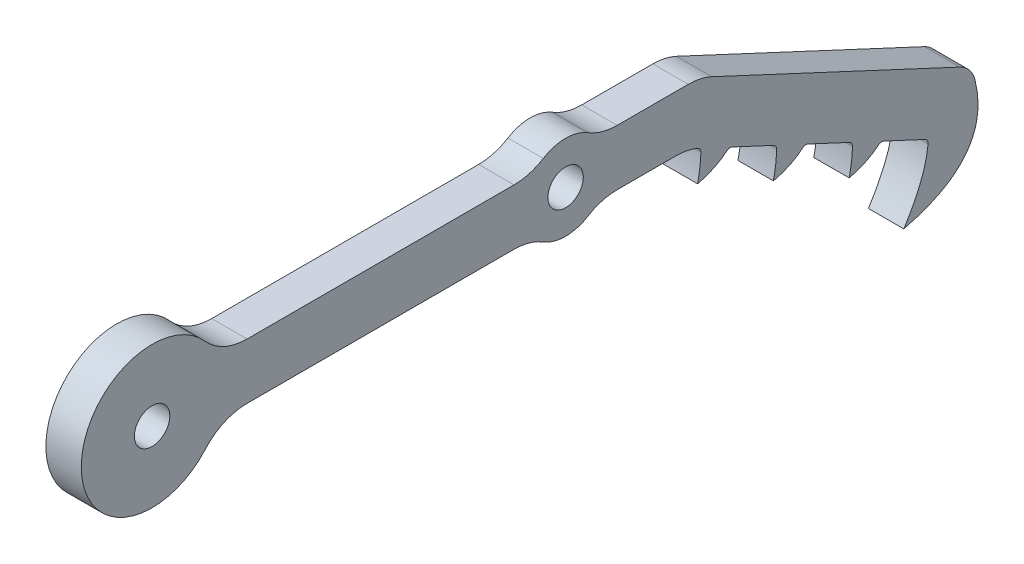
from build123d import *

# Parameters (mm, degrees)
BOSS_EXTRUDE1_DEPTH        = 6.35
F_1_4_0_2500_DOWEL_HOLE4_D = 6.35
FILLET1_R                  = 10
FILLET2_R                  = 10
FILLET4_R                  = 5
FILLET5_R                  = 1
FILLET6_R                  = 10


with BuildPart() as part:
    # Sketch1 → Boss-Extrude1 (new body)
    with BuildSketch(Plane(origin=(0, 0, 0), x_dir=(0, 0, -1), z_dir=(1, 0, 0))):
        with BuildLine():
            Line((-28.374994089, 49.86223243), (28.354545267, 49.86223243))
            ThreePointArc((28.354545267, 49.86223243), (34.104710482, 47.24223243), (39.854875697, 49.86223243))
            Line((39.854875697, 49.86223243), (56.104710487, 49.86223243))
            Line((56.104710487, 49.86223243), (58.379362515, 48.80154477))
            add(Edge.make_bspline(
                [(58.379362515, 48.80154477), (58.386228757, 46.363071997), (57.773854653, 43.567008128)],
                knots=[0, 0, 0, 1, 1, 1], degree=2))
            add(Edge.make_bspline(
                [(63.433148606, 46.444925613), (61.354068213, 44.407555536), (57.773854653, 43.567008128)],
                knots=[0.61808465, 0.61808465, 0.61808465, 1, 1, 1], degree=2))
            Line((63.433148606, 46.444925613), (71.973979321, 42.462270844))
            add(Edge.make_bspline(
                [(71.973979321, 42.462270844), (71.980845562, 40.023798071), (71.368471459, 37.227734202)],
                knots=[0, 0, 0, 1, 1, 1], degree=2))
            add(Edge.make_bspline(
                [(77.027765412, 40.105651687), (74.948685018, 38.06828161), (71.368471459, 37.227734202)],
                knots=[0.61808465, 0.61808465, 0.61808465, 1, 1, 1], degree=2))
            Line((77.027765412, 40.105651687), (85.568596126, 36.122996918))
            add(Edge.make_bspline(
                [(85.568596126, 36.122996918), (85.575462368, 33.684524145), (84.963088264, 30.888460276)],
                knots=[0, 0, 0, 1, 1, 1], degree=2))
            add(Edge.make_bspline(
                [(90.622382217, 33.766377761), (88.543301824, 31.729007684), (84.963088264, 30.888460276)],
                knots=[0.61808465, 0.61808465, 0.61808465, 1, 1, 1], degree=2))
            Line((90.622382217, 33.766377761), (99.163212932, 29.783722992))
            add(Edge.make_bspline(
                [(99.163212932, 29.783722992), (98.939072146, 24.65005498), (94.755179462, 18.075155142)],
                knots=[0, 0, 0, 1, 1, 1], degree=2))
            add(Edge.make_bspline(
                [(94.755179462, 18.075155142), (112.208752339, 22.33534385), (106.773416656, 37.268805905)],
                knots=[0.444949083, 0.444949083, 0.444949083, 1.444949083, 1.444949083, 1.444949083], degree=2))
            Line((106.773416656, 37.268805905), (58.321657114, 59.86223243))
            Line((58.321657114, 59.86223243), (39.854875697, 59.86223243))
            ThreePointArc((39.854875697, 59.86223243), (34.104710482, 62.48223243), (28.354545266, 59.86223243))
            Line((28.354545266, 59.86223243), (-28.374994089, 59.86223243))
            ThreePointArc((-28.374994089, 59.86223243), (-52.749324906, 54.86223243), (-28.374994089, 49.86223243))
        make_face()
    extrude(amount=BOSS_EXTRUDE1_DEPTH)

    # 1/4 (0.2500) Dowel Hole4 (through all)
    with Locations(Plane(origin=(6.35, 0, 0), x_dir=(0, 0, -1), z_dir=(1, 0, 0))):
        with Locations((-40.049324906, 54.86223243), (34.104710482, 54.86223243)):
            Hole(F_1_4_0_2500_DOWEL_HOLE4_D / 2)

    # Fillet1
    fillet1_edges = [part.edges().sort_by_distance(p)[0] for p in [
        (3.175, 59.86223243, 28.374994089),
        (3.175, 49.86223243, 28.374994089),
    ]]
    fillet(fillet1_edges, radius=FILLET1_R)

    # Fillet2
    fillet2_edges = [part.edges().sort_by_distance(p)[0] for p in [
        (3.175, 49.86223243, -56.104710487),
        (3.175, 59.86223243, -58.321657114),
    ]]
    fillet(fillet2_edges, radius=FILLET2_R)

    # Fillet4
    fillet4_edges = [part.edges().sort_by_distance(p)[0] for p in [
        (3.175, 37.268805905, -106.773416656),
    ]]
    fillet(fillet4_edges, radius=FILLET4_R)

    # Fillet5
    fillet5_edges = [part.edges().sort_by_distance(p)[0] for p in [
        (3.175, 33.766377761, -90.622382217),
        (3.175, 40.105651687, -77.027765412),
        (3.175, 46.444925613, -63.433148606),
        (3.175, 48.80154477, -58.379362515),
        (3.175, 42.462270844, -71.973979321),
        (3.175, 36.122996918, -85.568596126),
        (3.175, 29.783722992, -99.163212932),
    ]]
    fillet(fillet5_edges, radius=FILLET5_R)

    # Fillet6
    fillet6_edges = [part.edges().sort_by_distance(p)[0] for p in [
        (3.175, 49.86223243, -28.354545267),
        (3.175, 49.86223243, -39.854875697),
        (3.175, 59.86223243, -28.354545266),
        (3.175, 59.86223243, -39.854875697),
    ]]
    fillet(fillet6_edges, radius=FILLET6_R)


solid = part.part
